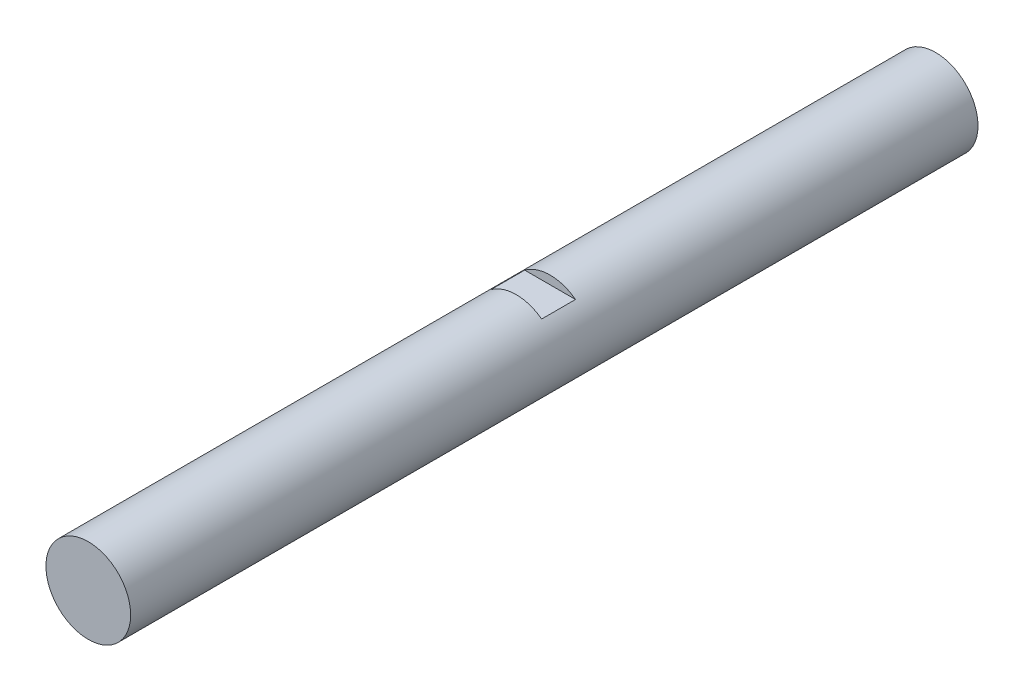
from build123d import *

# Parameters (mm, degrees)
SKETCH_1_R          = 5
EXTRUDE_1_DEPTH     = 100
CUT_EXTRUDE_START   = -45.5
CUT_EXTRUDE_1_DEPTH = 4


with BuildPart() as part:
    # Эскиз1 → Бобышка-Вытянуть1 (new body)
    with BuildSketch(Plane.XY):
        Circle(SKETCH_1_R)
    extrude(amount=EXTRUDE_1_DEPTH)

    # Эскиз2 → Вырез-Вытянуть1 (cut)
    with BuildSketch(Plane(origin=(0, 0, 0), x_dir=(-1, 0, 0), z_dir=(0, 0, -1)).offset(CUT_EXTRUDE_START)):
        with BuildLine():
            Line((-3, 4), (3, 4))
            ThreePointArc((3, 4), (0, 5), (-3, 4))
        make_face()
    extrude(amount=-CUT_EXTRUDE_1_DEPTH, mode=Mode.SUBTRACT)


solid = part.part
